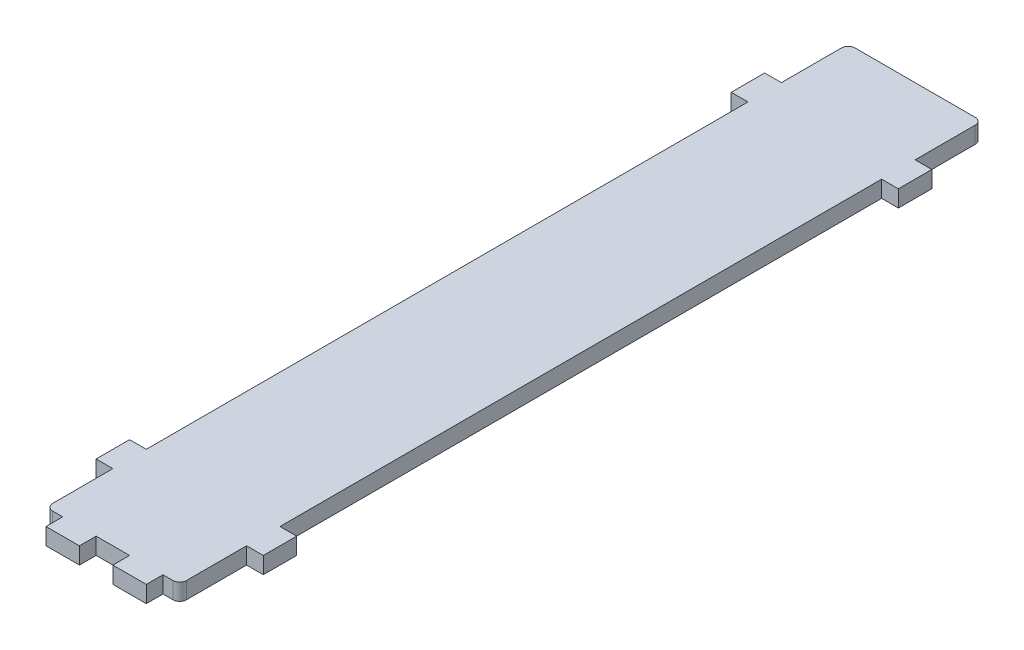
from build123d import *

# Parameters (mm, degrees)
SIDE_PLATE_DEPTH = 6.35
FILLET1_R        = 2.54


with BuildPart() as part:
    # Sketch1 → Side Plate (new body)
    with BuildSketch(Plane(origin=(0, 0, 0), x_dir=(1, 0, 0), z_dir=(0, 1, 0))):
        Polygon((0, 0), (6.35, 0), (6.35, -6.35), (19.05, -6.35), (19.05, 0), (31.75, 0), (31.75, -6.35), (44.45, -6.35), (44.45, 0), (50.8, 0), (50.8, 25.4), (57.15, 25.4), (57.15, 38.1), (50.8, 38.1), (50.8, 266.7), (57.15, 266.7), (57.15, 279.4), (50.8, 279.4), (50.8, 304.8), (0, 304.8), (0, 279.4), (-6.35, 279.4), (-6.35, 266.7), (0, 266.7), (0, 38.1), (-6.35, 38.1), (-6.35, 25.4), (0, 25.4), align=None)
    extrude(amount=SIDE_PLATE_DEPTH)

    # Fillet1
    fillet1_edges = [part.edges().sort_by_distance(p)[0] for p in [
        (50.8, 3.175, 0),
        (50.8, 3.175, -304.8),
        (0, 3.175, -304.8),
        (0, 3.175, 0),
    ]]
    fillet(fillet1_edges, radius=FILLET1_R)


solid = part.part
